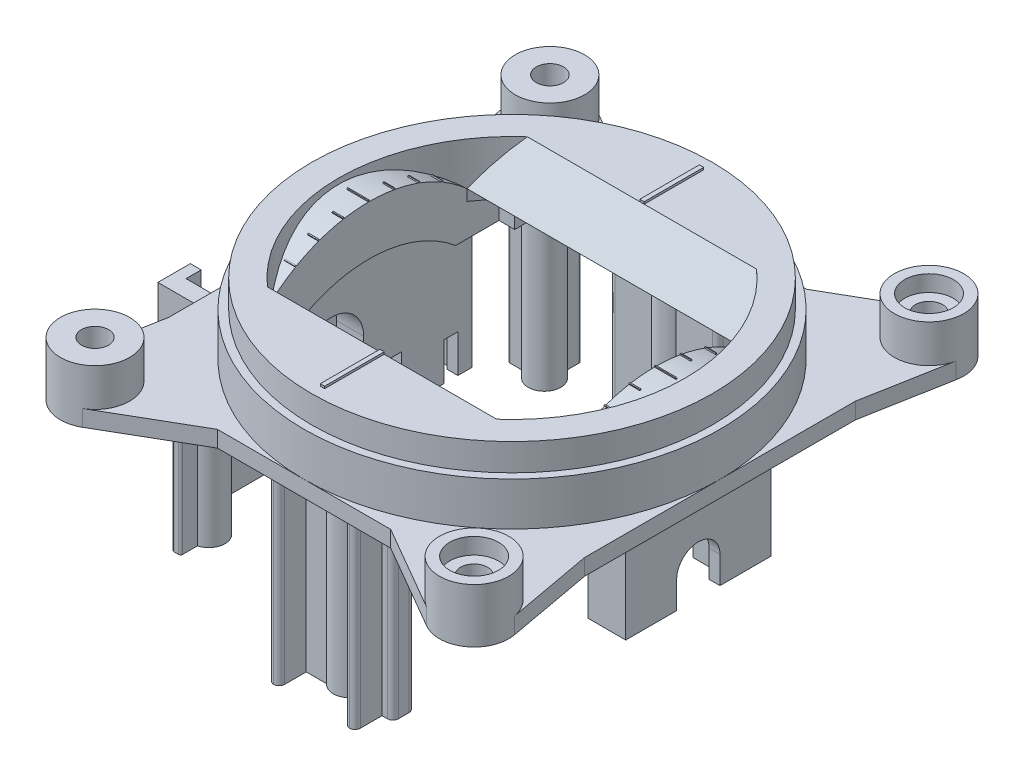
from build123d import *

# Parameters (mm, degrees)
SKETCH_1_R            = 1.25
SKETCH_1_R_2          = 1.250000001
EXTRUDE_1_DEPTH       = 1.5
SKETCH_2_R            = 19.2
EXTRUDE_2_DEPTH       = 4
SKETCH_3_R            = 18.5
EXTRUDE_3_DEPTH       = 2.5
CUT_EXTRUDE_1_DEPTH   = 64.834382046
EXTRUDE_4_REACH       = 57.649
EXTRUDE_5_REACH       = 57.649
LOFT_START            = 12.22231923
LOFT_1_DEPTH          = 26.4
LOFT_2_DEPTH          = 26.4
SKETCH_7_R            = 3.2
SKETCH_7_R_2          = 1.260964929
SKETCH_7_R_3          = 1.25
SKETCH_7_R_4          = 1.250000001
EXTRUDE_6_DEPTH       = 3.5
EXTRUDE_7_DEPTH       = 0.2
EXTRUDE_8_DEPTH       = 9
CUT_EXTRUDE_2_DEPTH   = 1
CUT_EXTRUDE_4_DEPTH   = 2.5
SKETCH_16_R           = 0.5
EXTRUDE_9_DEPTH       = 17
FILLET_1_R            = 0.5
EXTRUDE_10_DEPTH      = 9.5
EXTRUDE_11_DEPTH      = 7.3
EXTRUDE_12_DEPTH      = 4.5
EXTRUDE_12_DEPTH_BACK = 4.5
SKETCH_19_W           = 5
SKETCH_19_H           = 6.5
SKETCH_19_W_2         = 3
SKETCH_19_H_2         = 4.5
SKETCH_20_W           = 1.5
SKETCH_20_H           = 4.5
EXTRUDE_13_DEPTH      = 0.5
CUT_EXTRUDE_5_DEPTH   = 5
SKETCH_22_W           = 1
SKETCH_22_H           = 1.3
CUT_EXTRUDE_6_DEPTH   = 3.5
CUT_EXTRUDE_7_DEPTH   = 60.760522086
CUT_EXTRUDE_8_DEPTH   = 2.5
CUT_EXTRUDE_9_DEPTH   = 3.5
SKETCH_26_R           = 0.5
EXTRUDE_14_DEPTH      = 11
SKETCH_27_R           = 0.5
EXTRUDE_15_DEPTH      = 3
CUT_EXTRUDE_START     = -3
CUT_EXTRUDE_10_DEPTH  = 3
SKETCH_30_R           = 0.5
CUT_EXTRUDE_11_DEPTH  = 3
EXTRUDE_16_DEPTH      = 1.5
SKETCH_32_R           = 2
CUT_EXTRUDE_12_DEPTH  = 2
EXTRUDE_17_DEPTH      = 1
SKETCH_34_W           = 0.099999828
SKETCH_34_H           = 0.100092593
EXTRUDE_18_DEPTH      = 1
SKETCH_35_W           = 0.099999828
SKETCH_35_H           = 0.100092593
EXTRUDE_19_DEPTH      = 2
SKETCH_36_W           = 0.099999828
SKETCH_36_H           = 0.100092593
EXTRUDE_20_DEPTH      = 2
SKETCH_37_R           = 2.25
CUT_EXTRUDE_13_DEPTH  = 1.5


# Read off the part's stored shape, not the designer's step: 放样1, 放样2
with BuildPart() as part:
    # 草图1 → 凸台-拉伸1 (new body)
    with BuildSketch(Plane(origin=(0, 0, 0), x_dir=(1, 0, 0), z_dir=(0, 1, 0))):
        with BuildLine():
            Line((25.42231923, 38.4), (17.42231923, 38.4))
            Line((17.42231923, 38.4), (9.525315707, 42.969533863))
            ThreePointArc((9.525315707, 42.969533863), (6.080414011, 42.816331603), (4.774721912, 39.62478233))
            Line((4.774721912, 39.62478233), (6.22231923, 31.7))
            Line((6.22231923, 31.7), (6.22231923, 19.2))
            Line((6.22231923, 19.2), (6.22231923, 6.7))
            Line((6.22231923, 6.7), (4.774443017, -1.22478233))
            ThreePointArc((4.774443017, -1.22478233), (6.08001883, -4.416472668), (9.525004736, -4.569729073))
            Line((9.525004736, -4.569729073), (17.42231923, 0))
            Line((17.42231923, 0), (25.42231923, 0))
            Line((25.42231923, 0), (33.42231923, 0))
            Line((33.42231923, 0), (41.319322754, -4.569533864))
            ThreePointArc((41.319322754, -4.569533864), (44.76422445, -4.416331604), (46.06991655, -1.22478233))
            Line((46.06991655, -1.22478233), (44.62231923, 6.7))
            Line((44.62231923, 6.7), (44.62231923, 19.2))
            Line((44.62231923, 19.2), (44.62231923, 31.7))
            Line((44.62231923, 31.7), (46.057306844, 39.558242522))
            ThreePointArc((46.057306844, 39.558242522), (44.675699036, 42.876874905), (41.081449021, 42.817479106))
            Line((41.081449021, 42.817479106), (33.42231923, 38.4))
            Line((33.42231923, 38.4), (25.42231923, 38.4))
        make_face()
        with Locations(Location((7.922634211, 40.199802464, 0), (0, 0, 270))):
            Circle(SKETCH_1_R, mode=Mode.SUBTRACT)
        with Locations(Location((42.92231923, 40.2, 0), (0, 0, 270))):
            Circle(SKETCH_1_R, mode=Mode.SUBTRACT)
        with Locations(Location((42.92200425, -1.799802465, 0), (0, 0, 270))):
            Circle(SKETCH_1_R, mode=Mode.SUBTRACT)
        with Locations(Location((7.922319228, -1.799999996, 0), (0, 0, 270))):
            Circle(SKETCH_1_R_2, mode=Mode.SUBTRACT)
    extrude(amount=EXTRUDE_1_DEPTH)

    # 草图2 → 凸台-拉伸2 (add)
    with BuildSketch(Plane(origin=(0, 1.5, 0), x_dir=(1, 0, 0), z_dir=(0, 1, 0))):
        with Locations(Location((25.42231923, 19.2, 0), (0, 0, 270))):
            Circle(SKETCH_2_R)
    extrude(amount=EXTRUDE_2_DEPTH)

    # 草图3 → 凸台-拉伸3 (add)
    with BuildSketch(Plane(origin=(0, 5.5, 0), x_dir=(1, 0, 0), z_dir=(0, 1, 0))):
        with Locations(Location((25.42231923, 19.2, 0), (0, 0, 270))):
            Circle(SKETCH_3_R)
    extrude(amount=EXTRUDE_3_DEPTH)

    # 草图4 → 切除-拉伸1 (cut, through all)
    with BuildSketch(Plane(origin=(0, 8, 0), x_dir=(1, 0, 0), z_dir=(0, 1, 0))):
        with BuildLine():
            Line((25.42231923, 31.2), (14.839313986, 31.2))
            ThreePointArc((14.839313986, 31.2), (9.42231923, 19.2), (14.839313986, 7.2))
            Line((14.839313986, 7.2), (36.005324475, 7.2))
            ThreePointArc((36.005324475, 7.2), (41.42231923, 19.2), (36.005324475, 31.2))
            Line((36.005324475, 31.2), (25.42231923, 31.2))
        make_face()
    extrude(amount=-CUT_EXTRUDE_1_DEPTH, mode=Mode.SUBTRACT)

    # 草图5 → 凸台-拉伸4 (add, up to next)
    with BuildSketch(Plane.ZY.offset(-12.22231923), mode=Mode.PRIVATE) as extrude_4_sk1:
        with BuildLine():
            Line((-31.293386622, 0), (-7.106613378, 0))
            ThreePointArc((-7.106613378, 0), (-19.2, 7.5), (-31.293386622, 0))
        make_face()
    extrude_4_tool1 = extrude(extrude_4_sk1.sketch, amount=EXTRUDE_4_REACH, mode=Mode.PRIVATE) - part.part
    add(extrude_4_tool1.solids().sort_by_distance((12.222319, 3.085321, -19.2))[0])

    # 草图6 → 凸台-拉伸5 (add, up to next)
    with BuildSketch(Plane(origin=(38.62231923, 0, 0), x_dir=(0, 0, -1), z_dir=(1, 0, 0)), mode=Mode.PRIVATE) as extrude_5_sk1:
        with BuildLine():
            Line((10.157876356, 4.024470061), (10.157876356, 0))
            Line((10.157876356, 0), (28.242123644, 0))
            Line((28.242123644, 0), (28.242123644, 4.024470061))
            ThreePointArc((28.242123644, 4.024470061), (19.2, 7.5), (10.157876356, 4.024470061))
        make_face()
    extrude_5_tool1 = extrude(extrude_5_sk1.sketch, amount=EXTRUDE_5_REACH, mode=Mode.PRIVATE) - part.part
    add(extrude_5_tool1.solids().sort_by_distance((38.622319, 3.284174, -19.2))[0])

    # 放样1 outline → 放样1 (add)
    with BuildSketch(Plane.YZ.offset(LOFT_START)):
        Polygon((4.024470061, -31.2), (8, -31.2), (4.024470061, -28.242123644), align=None)
    extrude(amount=LOFT_1_DEPTH)

    # 放样2 outline → 放样2 (add)
    with BuildSketch(Plane.YZ.offset(LOFT_START)):
        Polygon((4.024470061, -7.2), (4.024470061, -10.157876356), (8, -7.2), align=None)
    extrude(amount=LOFT_2_DEPTH)

    # 草图7 → 凸台-拉伸6 (add)
    # profile 1 of 4: a face of its own
    with BuildSketch(Plane(origin=(0, 1.5, 0), x_dir=(1, 0, 0), z_dir=(0, 1, 0))):
        with Locations(Location((7.922634211, 40.199802464, 0), (0, 0, 59.944545015))):
            Circle(SKETCH_7_R)
        with Locations(Location((7.922634211, 40.199802464, 0), (0, 0, 270))):
            Circle(SKETCH_7_R_2, mode=Mode.SUBTRACT)
    # profile 2 of 4: a face of its own
    with BuildSketch(Plane(origin=(0, 1.5, 0), x_dir=(1, 0, 0), z_dir=(0, 1, 0))):
        with Locations(Location((42.92231923, 40.2, 0), (0, 0, 125.118678581))):
            Circle(SKETCH_7_R)
        with Locations(Location((42.92231923, 40.2, 0), (0, 0, 270))):
            Circle(SKETCH_7_R_3, mode=Mode.SUBTRACT)
    # profile 3 of 4: a face of its own
    with BuildSketch(Plane(origin=(0, 1.5, 0), x_dir=(1, 0, 0), z_dir=(0, 1, 0))):
        with Locations(Location((7.922319228, -1.799999996, 0), (0, 0, 169.644480104))):
            Circle(SKETCH_7_R)
        with Locations(Location((7.922319228, -1.799999996, 0), (0, 0, 270))):
            Circle(SKETCH_7_R_4, mode=Mode.SUBTRACT)
    # profile 4 of 4: a face of its own
    with BuildSketch(Plane(origin=(0, 1.5, 0), x_dir=(1, 0, 0), z_dir=(0, 1, 0))):
        with Locations(Location((42.92200425, -1.799802465, 0), (0, 0, 10.35192458))):
            Circle(SKETCH_7_R)
        with Locations(Location((42.92200425, -1.799802465, 0), (0, 0, 270))):
            Circle(SKETCH_7_R_3, mode=Mode.SUBTRACT)
    extrude(amount=EXTRUDE_6_DEPTH)

    # 草图8 → 凸台-拉伸7 (add)
    with BuildSketch(Plane(origin=(0, 8, 0), x_dir=(1, 0, 0), z_dir=(0, 1, 0))):
        Polygon((25.42231923, 31.2), (25.62231923, 31.2), (25.62231923, 36.7), (25.22231923, 36.7), (25.22231923, 31.2), align=None)
        Polygon((25.42231923, 7.2), (25.62231923, 7.2), (25.62231923, 1.7), (25.22231923, 1.7), (25.22231923, 7.2), align=None)
    extrude(amount=EXTRUDE_7_DEPTH)

    # 草图9 → 凸台-拉伸8 (add)
    with BuildSketch(Plane.XZ):
        Polygon((42.62231923, -19.2), (42.62231923, -25.9), (39.12231923, -25.9), (39.12231923, -12.5), (42.62231923, -12.5), align=None)
    extrude(amount=EXTRUDE_8_DEPTH)

    # 草图10 → 切除-拉伸2 (cut)
    with BuildSketch(Plane(origin=(42.62231923, 0, 0), x_dir=(0, 0, -1), z_dir=(1, 0, 0))):
        with BuildLine():
            Line((21.2, -6.5), (21.2, -9))
            Line((21.2, -9), (17.2, -9))
            Line((17.2, -9), (17.2, -6.5))
            ThreePointArc((17.2, -6.5), (19.2, -4.5), (21.2, -6.5))
        make_face()
    extrude(amount=-CUT_EXTRUDE_2_DEPTH, mode=Mode.SUBTRACT)

    # 草图14 → 切除-拉伸4 (cut)
    with BuildSketch(Plane.ZY.offset(-39.12231923)):
        with BuildLine():
            Line((-16.2, -9), (-22.2, -9))
            Line((-22.2, -9), (-22.2, -6))
            ThreePointArc((-22.2, -6), (-19.2, -3), (-16.2, -6))
            Line((-16.2, -6), (-16.2, -9))
        make_face()
    extrude(amount=-CUT_EXTRUDE_4_DEPTH, mode=Mode.SUBTRACT)

    # 草图16 → 凸台-拉伸9 (add)
    # profile 1 of 2: a face of its own
    with BuildSketch(Plane.XZ):
        with BuildLine():
            Line((21.42231923, -3.2), (20.42231923, -3.2))
            Line((20.42231923, -3.2), (20.42231923, -5.2))
            Line((20.42231923, -5.2), (24.304285242, -5.2))
            ThreePointArc((24.304285242, -5.2), (25.42231923, -5.7), (26.540353219, -5.2))
            Line((26.540353219, -5.2), (30.42231923, -5.2))
            Line((30.42231923, -5.2), (30.42231923, -3.2))
            Line((30.42231923, -3.2), (29.42231923, -3.2))
            Line((29.42231923, -3.2), (29.42231923, -0.7))
            Line((29.42231923, -0.7), (28.42231923, -0.7))
            Line((28.42231923, -0.7), (28.42231923, -3.2))
            Line((28.42231923, -3.2), (26.540353219, -3.2))
            ThreePointArc((26.540353219, -3.2), (25.42231923, -2.7), (24.304285242, -3.2))
            Line((24.304285242, -3.2), (22.42231923, -3.2))
            Line((22.42231923, -3.2), (22.42231923, -0.7))
            Line((22.42231923, -0.7), (21.42231923, -0.7))
            Line((21.42231923, -0.7), (21.42231923, -3.2))
        make_face()
        with Locations(Location((25.42231923, -4.2, 0), (0, 0, 270))):
            Circle(SKETCH_16_R, mode=Mode.SUBTRACT)
    # profile 2 of 2: a face of its own
    with BuildSketch(Plane.XZ):
        with BuildLine():
            Line((28.42231923, -35.2), (26.540353219, -35.2))
            ThreePointArc((26.540353219, -35.2), (25.42231923, -35.7), (24.304285242, -35.2))
            Line((24.304285242, -35.2), (22.42231923, -35.2))
            Line((22.42231923, -35.2), (22.42231923, -37.7))
            Line((22.42231923, -37.7), (21.42231923, -37.7))
            Line((21.42231923, -37.7), (21.42231923, -35.2))
            Line((21.42231923, -35.2), (20.42231923, -35.2))
            Line((20.42231923, -35.2), (20.42231923, -33.2))
            Line((20.42231923, -33.2), (24.304285242, -33.2))
            ThreePointArc((24.304285242, -33.2), (25.42231923, -32.7), (26.540353219, -33.2))
            Line((26.540353219, -33.2), (30.42231923, -33.2))
            Line((30.42231923, -33.2), (30.42231923, -35.2))
            Line((30.42231923, -35.2), (29.42231923, -35.2))
            Line((29.42231923, -35.2), (29.42231923, -37.7))
            Line((29.42231923, -37.7), (28.42231923, -37.7))
            Line((28.42231923, -37.7), (28.42231923, -35.2))
        make_face()
        with Locations(Location((25.42231923, -34.2, 0), (0, 0, 90))):
            Circle(SKETCH_16_R, mode=Mode.SUBTRACT)
    extrude(amount=EXTRUDE_9_DEPTH)

    # 圆角1
    fillet_1_edges = [part.edges().sort_by_distance(p)[0] for p in [
        (29.42231923, -8.5, -0.7),
        (28.42231923, -8.5, -0.7),
        (21.42231923, -8.5, -0.7),
        (22.42231923, -8.5, -0.7),
        (30.42231923, -8.5, -33.2),
        (30.42231923, -8.5, -35.2),
        (20.42231923, -8.5, -33.2),
        (20.42231923, -8.5, -35.2),
        (21.42231923, -8.5, -37.7),
        (22.42231923, -8.5, -37.7),
        (28.42231923, -8.5, -37.7),
        (29.42231923, -8.5, -37.7),
        (30.42231923, -8.5, -3.2),
        (30.42231923, -8.5, -5.2),
        (20.42231923, -8.5, -3.2),
        (20.42231923, -8.5, -5.2),
    ]]
    fillet(fillet_1_edges, radius=FILLET_1_R - 0.0001)  # a hair under: the kernel refuses the full size

    # 草图17 → 凸台-拉伸10 (add)
    with BuildSketch(Plane.XZ):
        Polygon((12.22231923, -6.2), (7.72231923, -6.2), (7.72231923, -12.7), (4.72231923, -12.7), (4.72231923, -19.2), (4.72231923, -25.7), (6.22231923, -25.7), (6.22231923, -32.2), (8.72231923, -32.2), (8.72231923, -7.5), (11.22231923, -7.5), (11.22231923, -11.2), (12.22231923, -11.2), align=None)
    extrude(amount=EXTRUDE_10_DEPTH)

    # 草图18 → 凸台-拉伸11 (add)
    with BuildSketch(Plane.XZ.offset(9.5)):
        Polygon((4.72231923, -12.7), (-0.77768077, -12.7), (-0.77768077, -15.7), (0.22231923, -15.7), (0.22231923, -14.3), (4.72231923, -14.3), align=None)
        Polygon((4.72231923, -25.7), (-0.77768077, -25.7), (-0.77768077, -22.7), (0.22231923, -22.7), (0.22231923, -24.1), (4.72231923, -24.1), align=None)
    extrude(amount=-EXTRUDE_11_DEPTH)

    # 草图19 → 凸台-拉伸12 (add, two sides: drawn at the far end of the back side and taken through both)
    with BuildSketch(Plane.XZ.offset(9.5).offset(-EXTRUDE_12_DEPTH_BACK)):
        with Locations((6.22231923, -28.95)):
            Rectangle(SKETCH_19_W, SKETCH_19_H)
        with Locations((6.22231923, -28.95)):
            Rectangle(SKETCH_19_W_2, SKETCH_19_H_2, mode=Mode.SUBTRACT)
    extrude(amount=EXTRUDE_12_DEPTH + EXTRUDE_12_DEPTH_BACK)

    # 草图20 → 凸台-拉伸13 (add)
    with BuildSketch(Plane(origin=(0, -5, 0), x_dir=(1, 0, 0), z_dir=(0, 1, 0))):
        with Locations((5.47231923, 28.95)):
            Rectangle(SKETCH_20_W, SKETCH_20_H)
    extrude(amount=-EXTRUDE_13_DEPTH)

    # 草图21 → 切除-拉伸5 (cut)
    with BuildSketch(Plane.XZ.offset(14)):
        Polygon((3.72231923, -32.2), (3.72231923, -29.2), (6.72231923, -32.2), align=None)
    extrude(amount=-CUT_EXTRUDE_5_DEPTH, mode=Mode.SUBTRACT)

    # 草图22 → 切除-拉伸6 (cut)
    with BuildSketch(Plane.XZ.offset(14)):
        with Locations((8.22231923, -30.25)):
            Rectangle(SKETCH_22_W, SKETCH_22_H)
    extrude(amount=-CUT_EXTRUDE_6_DEPTH, mode=Mode.SUBTRACT)

    # 草图23 → 切除-拉伸7 (cut, through all)
    with BuildSketch(Plane(origin=(8.72231923, 0, 0), x_dir=(0, 0, -1), z_dir=(1, 0, 0))):
        with BuildLine():
            Line((21.2, -6.5), (21.2, -9.5))
            Line((21.2, -9.5), (17.2, -9.5))
            Line((17.2, -9.5), (17.2, -6.5))
            ThreePointArc((17.2, -6.5), (19.2, -4.5), (21.2, -6.5))
        make_face()
    extrude(amount=-CUT_EXTRUDE_7_DEPTH, mode=Mode.SUBTRACT)

    # 草图24 → 切除-拉伸8 (cut)
    with BuildSketch(Plane(origin=(8.72231923, 0, 0), x_dir=(0, 0, -1), z_dir=(1, 0, 0))):
        with BuildLine():
            Line((19.2, -9.5), (22.2, -9.5))
            Line((22.2, -9.5), (22.2, -6.5))
            ThreePointArc((22.2, -6.5), (19.2, -3.5), (16.2, -6.5))
            Line((16.2, -6.5), (16.2, -9.5))
            Line((16.2, -9.5), (19.2, -9.5))
        make_face()
    extrude(amount=-CUT_EXTRUDE_8_DEPTH, mode=Mode.SUBTRACT)

    # 草图25 → 切除-拉伸9 (cut)
    with BuildSketch(Plane(origin=(12.22231923, 0, 0), x_dir=(0, 0, -1), z_dir=(1, 0, 0))):
        with BuildLine():
            Line((11.2, 0), (27.2, 0))
            ThreePointArc((27.2, 0), (19.2, 2.919742348), (11.2, 0))
        make_face()
    extrude(amount=-CUT_EXTRUDE_9_DEPTH, mode=Mode.SUBTRACT)

    # 草图26 → 凸台-拉伸14 (add)
    # profile 1 of 2: a face of its own
    with BuildSketch(Plane.XZ):
        with BuildLine():
            Line((12.52231923, -0.9), (12.52231923, -2.254316771))
            ThreePointArc((12.52231923, -2.254316771), (11.861659059, -2.639339828), (11.476636001, -3.3))
            Line((11.476636001, -3.3), (10.12231923, -3.3))
            ThreePointArc((10.12231923, -3.3), (9.980897874, -3.358578644), (9.92231923, -3.5))
            Line((9.92231923, -3.5), (9.92231923, -3.7))
            Line((9.92231923, -3.7), (9.92231923, -3.9))
            ThreePointArc((9.92231923, -3.9), (9.980897874, -4.041421356), (10.12231923, -4.1))
            Line((10.12231923, -4.1), (11.476636001, -4.1))
            ThreePointArc((11.476636001, -4.1), (13.982979402, -4.760660172), (13.32231923, -2.254316771))
            Line((13.32231923, -2.254316771), (13.32231923, -0.9))
            ThreePointArc((13.32231923, -0.9), (13.263740587, -0.758578644), (13.12231923, -0.7))
            Line((13.12231923, -0.7), (12.92231923, -0.7))
            Line((12.92231923, -0.7), (12.72231923, -0.7))
            ThreePointArc((12.72231923, -0.7), (12.580897874, -0.758578644), (12.52231923, -0.9))
        make_face()
        with Locations(Location((12.92231923, -3.7, 0), (0, 0, 90))):
            Circle(SKETCH_26_R, mode=Mode.SUBTRACT)
    # profile 2 of 2: a face of its own
    with BuildSketch(Plane.XZ):
        with BuildLine():
            Line((9.92231923, -34.7), (9.92231923, -34.9))
            ThreePointArc((9.92231923, -34.9), (9.980897874, -35.041421356), (10.12231923, -35.1))
            Line((10.12231923, -35.1), (11.476636001, -35.1))
            ThreePointArc((11.476636001, -35.1), (11.861659059, -35.760660172), (12.52231923, -36.145683229))
            Line((12.52231923, -36.145683229), (12.52231923, -37.5))
            ThreePointArc((12.52231923, -37.5), (12.580897874, -37.641421356), (12.72231923, -37.7))
            Line((12.72231923, -37.7), (12.92231923, -37.7))
            Line((12.92231923, -37.7), (13.12231923, -37.7))
            ThreePointArc((13.12231923, -37.7), (13.263740587, -37.641421356), (13.32231923, -37.5))
            Line((13.32231923, -37.5), (13.32231923, -36.145683229))
            ThreePointArc((13.32231923, -36.145683229), (13.982979402, -33.639339828), (11.476636001, -34.3))
            Line((11.476636001, -34.3), (10.12231923, -34.3))
            ThreePointArc((10.12231923, -34.3), (9.980897874, -34.358578644), (9.92231923, -34.5))
            Line((9.92231923, -34.5), (9.92231923, -34.7))
        make_face()
        with Locations(Location((12.92231923, -34.7, 0), (0, 0, 270))):
            Circle(SKETCH_26_R, mode=Mode.SUBTRACT)
    extrude(amount=EXTRUDE_14_DEPTH)

    # 草图27 → 凸台-拉伸15 (add)
    with BuildSketch(Plane.XZ.offset(11)):
        with BuildLine():
            Line((13.32231923, -37.5), (13.32231923, -36.145683229))
            ThreePointArc((13.32231923, -36.145683229), (13.982979402, -33.639339828), (11.476636001, -34.3))
            Line((11.476636001, -34.3), (10.12231923, -34.3))
            ThreePointArc((10.12231923, -34.3), (9.980897874, -34.358578644), (9.92231923, -34.5))
            Line((9.92231923, -34.5), (9.92231923, -34.9))
            ThreePointArc((9.92231923, -34.9), (9.980897874, -35.041421356), (10.12231923, -35.1))
            Line((10.12231923, -35.1), (11.476636001, -35.1))
            ThreePointArc((11.476636001, -35.1), (11.861659059, -35.760660172), (12.52231923, -36.145683229))
            Line((12.52231923, -36.145683229), (12.52231923, -37.5))
            ThreePointArc((12.52231923, -37.5), (12.580897874, -37.641421356), (12.72231923, -37.7))
            Line((12.72231923, -37.7), (13.12231923, -37.7))
            ThreePointArc((13.12231923, -37.7), (13.263740587, -37.641421356), (13.32231923, -37.5))
        make_face()
        with Locations(Location((12.92231923, -34.7, 0), (0, 0, 270))):
            Circle(SKETCH_27_R, mode=Mode.SUBTRACT)
    extrude(amount=EXTRUDE_15_DEPTH)

    # 草图28 → 切除-拉伸10 (cut)
    with BuildSketch(Plane.XZ.offset(CUT_EXTRUDE_START)):
        with BuildLine():
            Line((24.304285242, -33.2), (20.92231923, -33.2))
            ThreePointArc((20.92231923, -33.2), (20.56876584, -33.346446609), (20.42231923, -33.7))
            Line((20.42231923, -33.7), (20.42231923, -34.7))
            ThreePointArc((20.42231923, -34.7), (20.56876584, -35.053553391), (20.92231923, -35.2))
            Line((20.92231923, -35.2), (21.42231923, -35.2))
            Line((21.42231923, -35.2), (21.42231923, -36.644555024))
            ThreePointArc((21.42231923, -36.644555024), (17.304098761, -35.150140953), (13.67231923, -32.7))
            Line((13.67231923, -32.7), (13.67231923, -31.2))
            Line((13.67231923, -31.2), (12.22231923, -31.2))
            Line((12.22231923, -31.2), (12.22231923, -7.2))
            Line((12.22231923, -7.2), (13.67231923, -7.2))
            Line((13.67231923, -7.2), (13.67231923, -5.7))
            ThreePointArc((13.67231923, -5.7), (25.42231923, -1.302723671), (37.17231923, -5.7))
            Line((37.17231923, -5.7), (37.17231923, -7.2))
            Line((37.17231923, -7.2), (38.62231923, -7.2))
            Line((38.62231923, -7.2), (38.62231923, -31.2))
            Line((38.62231923, -31.2), (37.17231923, -31.2))
            Line((37.17231923, -31.2), (37.17231923, -32.7))
            ThreePointArc((37.17231923, -32.7), (33.5405397, -35.150140953), (29.42231923, -36.644555024))
            Line((29.42231923, -36.644555024), (29.42231923, -35.2))
            Line((29.42231923, -35.2), (29.92231923, -35.2))
            ThreePointArc((29.92231923, -35.2), (30.275872621, -35.053553391), (30.42231923, -34.7))
            Line((30.42231923, -34.7), (30.42231923, -33.7))
            ThreePointArc((30.42231923, -33.7), (30.275872621, -33.346446609), (29.92231923, -33.2))
            Line((29.92231923, -33.2), (26.540353219, -33.2))
            ThreePointArc((26.540353219, -33.2), (25.42231923, -32.7), (24.304285242, -33.2))
        make_face()
        with BuildLine():
            Line((22.42231923, -35.2), (24.304285242, -35.2))
            ThreePointArc((24.304285242, -35.2), (25.42231923, -35.7), (26.540353219, -35.2))
            Line((26.540353219, -35.2), (28.42231923, -35.2))
            Line((28.42231923, -35.2), (28.42231923, -36.844049989))
            ThreePointArc((28.42231923, -36.844049989), (25.42231923, -37.097276329), (22.42231923, -36.844049989))
            Line((22.42231923, -36.844049989), (22.42231923, -35.2))
        make_face()
    extrude(amount=CUT_EXTRUDE_10_DEPTH, mode=Mode.SUBTRACT)

    # 草图30 → 切除-拉伸11 (cut)
    with BuildSketch(Plane.XZ.offset(9.5)):
        with Locations(Location((6.72231923, -14.7, 0), (0, 0, 270))):
            Circle(SKETCH_30_R)
        with Locations(Location((6.72231923, -23.7, 0), (0, 0, 270))):
            Circle(SKETCH_30_R)
        with Locations(Location((40.62231923, -14.7, 0), (0, 0, 270))):
            Circle(SKETCH_30_R)
        with Locations(Location((40.62231923, -23.55, 0), (0, 0, 270))):
            Circle(SKETCH_30_R)
    extrude(amount=-CUT_EXTRUDE_11_DEPTH, mode=Mode.SUBTRACT)

    # 草图31 → 凸台-拉伸16 (add)
    with BuildSketch(Plane.ZY.offset(-4.72231923)):
        Polygon((-19.2, -1.5), (-20.2, -1.5), (-20.2, -3), (-18.2, -3), (-18.2, -1.5), align=None)
    extrude(amount=EXTRUDE_16_DEPTH)

    # 草图32 → 切除-拉伸12 (cut)
    with BuildSketch(Plane.XZ):
        with Locations(Location((7.922319228, 1.799999996, 0), (0, 0, 270))):
            Circle(SKETCH_32_R)
        with Locations(Location((42.92200425, 1.799802465, 0), (0, 0, 270))):
            Circle(SKETCH_32_R)
        with Locations(Location((7.922634211, -40.199802464, 0), (0, 0, 270))):
            Circle(SKETCH_32_R)
        with Locations(Location((42.92231923, -40.2, 0), (0, 0, 270))):
            Circle(SKETCH_32_R)
    extrude(amount=-CUT_EXTRUDE_12_DEPTH, mode=Mode.SUBTRACT)

    # 草图33 → 凸台-拉伸17 (add)
    with BuildSketch(Plane(origin=(12.22231923, 0, 0), x_dir=(0, 0, -1), z_dir=(1, 0, 0))):
        Polygon((19.150000086, 7.6), (19.249999914, 7.6), (19.249999914, 7.499907407), (19.2, 7.5), (19.150000086, 7.499907407), align=None)
        Polygon((23.852165064, 6.779566647), (23.899149229, 6.762464359), (23.86457022, 6.668535222), (23.77060189, 6.702739797), (23.804837676, 6.796793869), align=None)
        Polygon((21.561615216, 7.393385441), (21.611779554, 7.384540115), (21.594398049, 7.285964699), (21.494069373, 7.303655352), (21.511450878, 7.402230767), align=None)
        Polygon((26, 5.777945491), (26.04330127, 5.752945491), (25.992936971, 5.66644793), (25.906971794, 5.716079948), (25.957017412, 5.8027615), align=None)
        Polygon((16.888549122, 7.402230767), (16.838384784, 7.393385441), (16.788220446, 7.384540115), (16.805601951, 7.285964699), (16.905930627, 7.303655352), align=None)
        Polygon((14.595162324, 6.796793869), (14.547834936, 6.779566647), (14.500850771, 6.762464359), (14.53542978, 6.668535222), (14.62939811, 6.702739797), align=None)
        Polygon((12.442982588, 5.8027615), (12.4, 5.777945491), (12.35669873, 5.752945491), (12.407063029, 5.66644793), (12.493028206, 5.716079948), align=None)
    extrude(amount=-EXTRUDE_17_DEPTH)

    # 草图34 → 凸台-拉伸18 (add)
    with BuildSketch(Plane.ZY.offset(-38.62231923)):
        Polygon((-12.493028206, 5.716079948), (-12.442982588, 5.8027615), (-12.35669873, 5.752945491), (-12.407063029, 5.66644793), align=None)
        Polygon((-14.500850771, 6.762464359), (-14.53542978, 6.668535222), (-14.62939811, 6.702739797), (-14.595162324, 6.796793869), align=None)
        Polygon((-16.788220446, 7.384540115), (-16.805601951, 7.285964699), (-16.905930627, 7.303655352), (-16.888549122, 7.402230767), align=None)
        with Locations((-19.2, 7.549953703)):
            Rectangle(SKETCH_34_W, SKETCH_34_H)
        Polygon((-21.511450878, 7.402230767), (-21.494069373, 7.303655352), (-21.594398049, 7.285964699), (-21.611779554, 7.384540115), align=None)
        Polygon((-23.804837676, 6.796793869), (-23.77060189, 6.702739797), (-23.86457022, 6.668535222), (-23.899149229, 6.762464359), align=None)
        Polygon((-25.957017412, 5.8027615), (-25.906971794, 5.716079948), (-25.992936971, 5.66644793), (-26.04330127, 5.752945491), align=None)
    extrude(amount=-EXTRUDE_18_DEPTH)

    # 草图35 → 凸台-拉伸19 (add)
    with BuildSketch(Plane(origin=(12.22231923, 0, 0), x_dir=(0, 0, -1), z_dir=(1, 0, 0))):
        with Locations((19.2, 7.549953703)):
            Rectangle(SKETCH_35_W, SKETCH_35_H)
    extrude(amount=-EXTRUDE_19_DEPTH)

    # 草图36 → 凸台-拉伸20 (add)
    with BuildSketch(Plane.ZY.offset(-38.62231923)):
        with Locations((-19.2, 7.549953703)):
            Rectangle(SKETCH_36_W, SKETCH_36_H)
    extrude(amount=-EXTRUDE_20_DEPTH)

    # 草图37 → 切除-拉伸13 (cut)
    with BuildSketch(Plane(origin=(0, 5, 0), x_dir=(1, 0, 0), z_dir=(0, 1, 0))):
        with Locations(Location((42.92231923, 40.2, 0), (0, 0, 270))):
            Circle(SKETCH_37_R)
        with Locations(Location((42.92200425, -1.799802465, 0), (0, 0, 270))):
            Circle(SKETCH_37_R)
    extrude(amount=-CUT_EXTRUDE_13_DEPTH, mode=Mode.SUBTRACT)


solid = part.part
